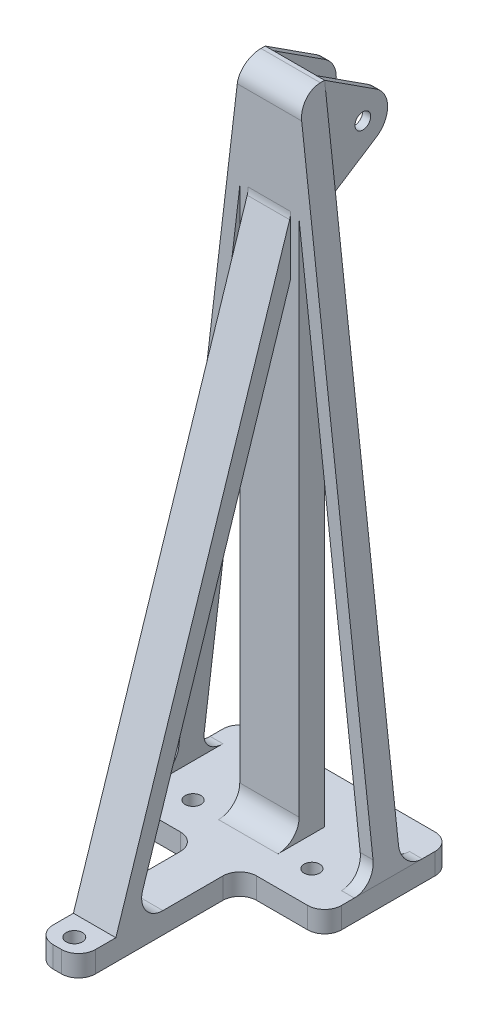
from build123d import *

# Parameters (mm, degrees)
SKETCH1_W                       = 50
SKETCH1_H                       = 30
SKETCH1_R                       = 1.85
BOSS_EXTRUDE1_DEPTH             = 5
BOSS_EXTRUDE2_DEPTH             = 3
BOSS_EXTRUDE2_DEPTH_BACK        = 3
SKETCH4_R                       = 1.85
BOSS_EXTRUDE3_DEPTH             = 7
CUT_EXTRUDE1_REACH              = 162.37
SKETCH6_W                       = 10.2
SKETCH6_H                       = 14.85
SKETCH8_R                       = 1.85
SKETCH8_W                       = 10
SKETCH8_H                       = 38
SKETCH8_R_2                     = 1.917002372
BOSS_EXTRUDE4_DEPTH             = 5
BOSS_EXTRUDE5_REACH             = 169.955
BOSS_EXTRUDE5_DIRECTION_2_REACH = 169.955
FILLET1_R                       = 5
FILLET2_R                       = 4


with BuildPart() as part:
    # Sketch1 → Boss-Extrude1 (new body)
    with BuildSketch(Plane(origin=(0, 0, 0), x_dir=(1, 0, 0), z_dir=(0, 1, 0))):
        Rectangle(SKETCH1_W, SKETCH1_H)
        with Locations(Location((0, 7, 0), (0, 0, 270))):
            Circle(SKETCH1_R, mode=Mode.SUBTRACT)
        with Locations(Location((14, 7, 0), (0, 0, 270))):
            Circle(SKETCH1_R, mode=Mode.SUBTRACT)
        with Locations(Location((-14, 7, 0), (0, 0, 270))):
            Circle(SKETCH1_R, mode=Mode.SUBTRACT)
        with Locations(Location((14, -7, 0), (0, 0, 90))):
            Circle(SKETCH1_R, mode=Mode.SUBTRACT)
        with Locations(Location((0, -7, 0), (0, 0, 90))):
            Circle(SKETCH1_R, mode=Mode.SUBTRACT)
        with Locations(Location((-14, -7, 0), (0, 0, 90))):
            Circle(SKETCH1_R, mode=Mode.SUBTRACT)
    extrude(amount=BOSS_EXTRUDE1_DEPTH)

    # Sketch3 → Boss-Extrude2 (add, two sides: drawn at the far end of the back side and taken through both)
    with BuildSketch(Plane.XY.offset(-BOSS_EXTRUDE2_DEPTH_BACK)):
        Polygon((-7, 157.4), (-25, 5), (-21.97914743, 5), (-7, 131.823448239), align=None)
        Polygon((25, 5), (7, 157.4), (7, 131.823448239), (21.97914743, 5), align=None)
        Polygon((0, 157.4), (-7, 157.4), (-7, 131.823448239), (-7, 5), (0, 5), align=None)
        Polygon((7, 157.4), (0, 157.4), (0, 5), (7, 5), (7, 131.823448239), align=None)
    extrude(amount=BOSS_EXTRUDE2_DEPTH + BOSS_EXTRUDE2_DEPTH_BACK)

    # Sketch4 → Boss-Extrude3 (add)
    with BuildSketch(Plane(origin=(0, 0, 0), x_dir=(0, 0, -1), z_dir=(1, 0, 0))):
        with BuildLine():
            Line((3, 131.823448239), (15.177137146, 139.699667569))
            ThreePointArc((15.177137146, 139.699667569), (17.85, 144.611724119), (15.177137146, 149.52378067))
            Line((15.177137146, 149.52378067), (3, 157.4))
            Line((3, 157.4), (3, 131.823448239))
        make_face()
        with Locations(Location((12, 144.611724119, 0), (0, 0, 180))):
            Circle(SKETCH4_R, mode=Mode.SUBTRACT)
    boss_extrude3 = extrude(amount=BOSS_EXTRUDE3_DEPTH)

    # Mirror1: Boss-Extrude3 across plane
    add(boss_extrude3.mirror(Plane(origin=(0, 0, 0), x_dir=(0, 0, 1), z_dir=(1, 0, 0))))

    # Cut-Extrude1: up to this plane
    cut_extrude1_end = Plane(origin=(7, 91.572994836, 59.229766685), z_dir=(0, 0.8396677864426271, 0.5431003667928599))
    # Sketch6 → Cut-Extrude1 (cut, up to the surface)
    with BuildSketch(Plane(origin=(0, 157.4, 0), x_dir=(1, 0, 0), z_dir=(0, 1, 0)), mode=Mode.PRIVATE) as cut_extrude1_sk1:
        with Locations((0, 10.425)):
            Rectangle(SKETCH6_W, SKETCH6_H)
    cut_extrude1_tool1 = split(extrude(cut_extrude1_sk1.sketch, amount=-CUT_EXTRUDE1_REACH, mode=Mode.PRIVATE), bisect_by=cut_extrude1_end, keep=Keep.BOTH, mode=Mode.PRIVATE)
    add(cut_extrude1_tool1.solids().sort_by_distance((0, 157.4, -10.425))[0], mode=Mode.SUBTRACT)

    # Sketch8 → Boss-Extrude4 (add)
    # profile 1 of 2: a face of its own
    with BuildSketch(Plane.XZ):
        with Locations((0, 7)):
            Circle(SKETCH8_R)
    # profile 2 of 2: a face of its own
    with BuildSketch(Plane.XZ):
        with Locations((0, 34)):
            Rectangle(SKETCH8_W, SKETCH8_H)
        with Locations(Location((0, 49, 0), (0, 0, 270))):
            Circle(SKETCH8_R_2, mode=Mode.SUBTRACT)
    extrude(amount=-BOSS_EXTRUDE4_DEPTH)

    # Boss-Extrude5: up to this face of the body (flat: up to its plane)
    boss_extrude5_end = Plane(part.part.faces().sort_by_distance((5, 2.5, 34))[0])
    # Sketch9 → Boss-Extrude5 (add, up to the picked face)
    with BuildSketch(Plane(origin=(0, 0, 0), x_dir=(0, 0, -1), z_dir=(1, 0, 0)), mode=Mode.PRIVATE) as boss_extrude5_sk1:
        Polygon((-3, 131.823448239), (-44.205833274, 5), (-40, 5), (-3, 118.878720851), align=None)
    boss_extrude5_tool1 = split(extrude(boss_extrude5_sk1.sketch, amount=BOSS_EXTRUDE5_REACH, mode=Mode.PRIVATE), bisect_by=boss_extrude5_end, keep=Keep.BOTH, mode=Mode.PRIVATE)
    add(boss_extrude5_tool1.solids().sort_by(Axis((0, 65.233555, 22.570307), (1, 0, 0)))[0])

    # Boss-Extrude5 direction 2: up to this face of the body (flat: up to its plane)
    boss_extrude5_direction_2_end = Plane(part.part.faces().sort_by_distance((-5, 2.5, 34))[0])
    # Sketch9 → Boss-Extrude5 direction 2 (add, up to the picked face)
    with BuildSketch(Plane(origin=(0, 0, 0), x_dir=(0, 0, -1), z_dir=(1, 0, 0)), mode=Mode.PRIVATE) as boss_extrude5_direction_2_sk1:
        Polygon((-3, 131.823448239), (-44.205833274, 5), (-40, 5), (-3, 118.878720851), align=None)
    boss_extrude5_direction_2_tool1 = split(extrude(boss_extrude5_direction_2_sk1.sketch, amount=-BOSS_EXTRUDE5_DIRECTION_2_REACH, mode=Mode.PRIVATE), bisect_by=boss_extrude5_direction_2_end, keep=Keep.BOTH, mode=Mode.PRIVATE)
    add(boss_extrude5_direction_2_tool1.solids().sort_by(Axis((0, 65.233555, 22.570307), (-1, 0, 0)))[0])

    # Fillet1
    # the kernel refuses this fillet: 5 mm, written as the material it adds along each edge
    with BuildSketch(Plane(origin=(-5, 131.823448239, 3), x_dir=(0, -0.9510600491338266, 0.3090061212040359), z_dir=(1, 0, 0))) as fillet1_piece_1:
        with BuildLine():
            CenterArc((FILLET1_R * 0.158378580578, -FILLET1_R), FILLET1_R, 90, 17.999344954)
            Line((-FILLET1_R * 0.150627540626, -FILLET1_R * 0.0489399508662), (0, 0))
            Line((0, 0), (FILLET1_R * 0.158378580578, 0))
        make_face()
    extrude(amount=10)
    with BuildSketch(Plane(origin=(-5, 5, 40), x_dir=(0, 0.9510600491338281, -0.3090061212040312), z_dir=(1, 0, 0))) as fillet1_piece_2:
        with BuildLine():
            CenterArc((FILLET1_R * 1.37636537503, -FILLET1_R), FILLET1_R, 90, 107.999344954)
            Line((FILLET1_R * 0.425305325898, -FILLET1_R * 1.3090061212), (0, 0))
            Line((0, 0), (FILLET1_R * 1.37636537503, 0))
        make_face()
    extrude(amount=10)
    with BuildSketch(Plane(origin=(9.47914743, 5, 3), x_dir=(0, 1, 0), z_dir=(1, 0, 0))) as fillet1_piece_3_section:
        with BuildLine():
            CenterArc((FILLET1_R, FILLET1_R), FILLET1_R, 180, 90)
            Line((0, FILLET1_R), (0, 0))
            Line((0, 0), (FILLET1_R, 0))
        make_face()
    fillet1_piece_3 = extrude(amount=15.52085257, mode=Mode.PRIVATE)
    fillet1_piece_3 = split(fillet1_piece_3, bisect_by=Plane(origin=(21.86620474, 5.956248104, 4.13176941), z_dir=(0.9930971241558421, 0.11729493592391835, 0)), keep=Keep.TOP, mode=Mode.PRIVATE)
    fillet1_piece_3 = split(fillet1_piece_3, bisect_by=Plane(origin=(24.845496113, 6.308132911, 4.13176941), z_dir=(-0.9930971241558421, -0.11729493592391835, 0)), keep=Keep.TOP, mode=Mode.PRIVATE)
    add(fillet1_piece_3)
    with BuildSketch(Plane(origin=(-25, 5, -3), x_dir=(0, 1, 0), z_dir=(1, 0, 0))) as fillet1_piece_4_section:
        with BuildLine():
            CenterArc((FILLET1_R, -FILLET1_R), FILLET1_R, 90, 90)
            Line((0, -FILLET1_R), (0, 0))
            Line((0, 0), (FILLET1_R, 0))
        make_face()
    fillet1_piece_4 = extrude(amount=15.52085257, mode=Mode.PRIVATE)
    fillet1_piece_4 = split(fillet1_piece_4, bisect_by=Plane(origin=(-24.845496113, 6.308132911, -4.13176941), z_dir=(0.9930971241558421, -0.11729493592391835, 0)), keep=Keep.TOP, mode=Mode.PRIVATE)
    fillet1_piece_4 = split(fillet1_piece_4, bisect_by=Plane(origin=(-21.86620474, 5.956248104, -4.13176941), z_dir=(-0.9930971241558421, 0.11729493592391835, 0)), keep=Keep.TOP, mode=Mode.PRIVATE)
    add(fillet1_piece_4)
    with BuildSketch(Plane(origin=(9.47914743, 5, -3), x_dir=(0, 1, 0), z_dir=(1, 0, 0))) as fillet1_piece_5_section:
        with BuildLine():
            CenterArc((FILLET1_R, -FILLET1_R), FILLET1_R, 90, 90)
            Line((0, -FILLET1_R), (0, 0))
            Line((0, 0), (FILLET1_R, 0))
        make_face()
    fillet1_piece_5 = extrude(amount=15.52085257, mode=Mode.PRIVATE)
    fillet1_piece_5 = split(fillet1_piece_5, bisect_by=Plane(origin=(24.845496113, 6.308132911, -4.13176941), z_dir=(-0.9930971241558421, -0.11729493592391835, 0)), keep=Keep.TOP, mode=Mode.PRIVATE)
    fillet1_piece_5 = split(fillet1_piece_5, bisect_by=Plane(origin=(21.86620474, 5.956248104, -4.13176941), z_dir=(0.9930971241558421, 0.11729493592391835, 0)), keep=Keep.TOP, mode=Mode.PRIVATE)
    add(fillet1_piece_5)
    with BuildSketch(Plane(origin=(-25, 5, 3), x_dir=(0, 1, 0), z_dir=(1, 0, 0))) as fillet1_piece_6_section:
        with BuildLine():
            CenterArc((FILLET1_R, FILLET1_R), FILLET1_R, 180, 90)
            Line((0, FILLET1_R), (0, 0))
            Line((0, 0), (FILLET1_R, 0))
        make_face()
    fillet1_piece_6 = extrude(amount=15.52085257, mode=Mode.PRIVATE)
    fillet1_piece_6 = split(fillet1_piece_6, bisect_by=Plane(origin=(-24.845496113, 6.308132911, 4.13176941), z_dir=(0.9930971241558421, -0.11729493592391835, 0)), keep=Keep.TOP, mode=Mode.PRIVATE)
    fillet1_piece_6 = split(fillet1_piece_6, bisect_by=Plane(origin=(-21.86620474, 5.956248104, 4.13176941), z_dir=(-0.9930971241558421, 0.11729493592391835, 0)), keep=Keep.TOP, mode=Mode.PRIVATE)
    add(fillet1_piece_6)
    with BuildSketch(Plane(origin=(-7, 5, 3), x_dir=(0, 1, 0), z_dir=(1, 0, 0))) as fillet1_piece_7:
        with BuildLine():
            CenterArc((FILLET1_R, FILLET1_R), FILLET1_R, 180, 90)
            Line((0, FILLET1_R), (0, 0))
            Line((0, 0), (FILLET1_R, 0))
        make_face()
    extrude(amount=14)
    # the kernel refuses this fillet: 5 mm, written as the material it takes off along each edge
    with BuildSketch(Plane(origin=(-19.5, 157.4, 3), x_dir=(0, -1, 0), z_dir=(1, 0, 0))) as fillet1_2_piece_1:
        with BuildLine():
            CenterArc((FILLET1_R, FILLET1_R), FILLET1_R, 180, 90)
            Line((0, FILLET1_R), (0, 0))
            Line((0, 0), (FILLET1_R, 0))
        make_face()
    extrude(amount=39, mode=Mode.SUBTRACT)

    # Fillet2
    fillet2_edges = [part.edges().sort_by_distance(p)[0] for p in [
        (5, 2.5, 15),
        (5, 2.5, 53),
        (-5, 2.5, 53),
        (-5, 2.5, 15),
        (25, 2.5, 15),
        (-25, 2.5, 15),
        (-25, 2.5, -15),
        (25, 2.5, -15),
    ]]
    fillet(fillet2_edges, radius=FILLET2_R)


solid = part.part
